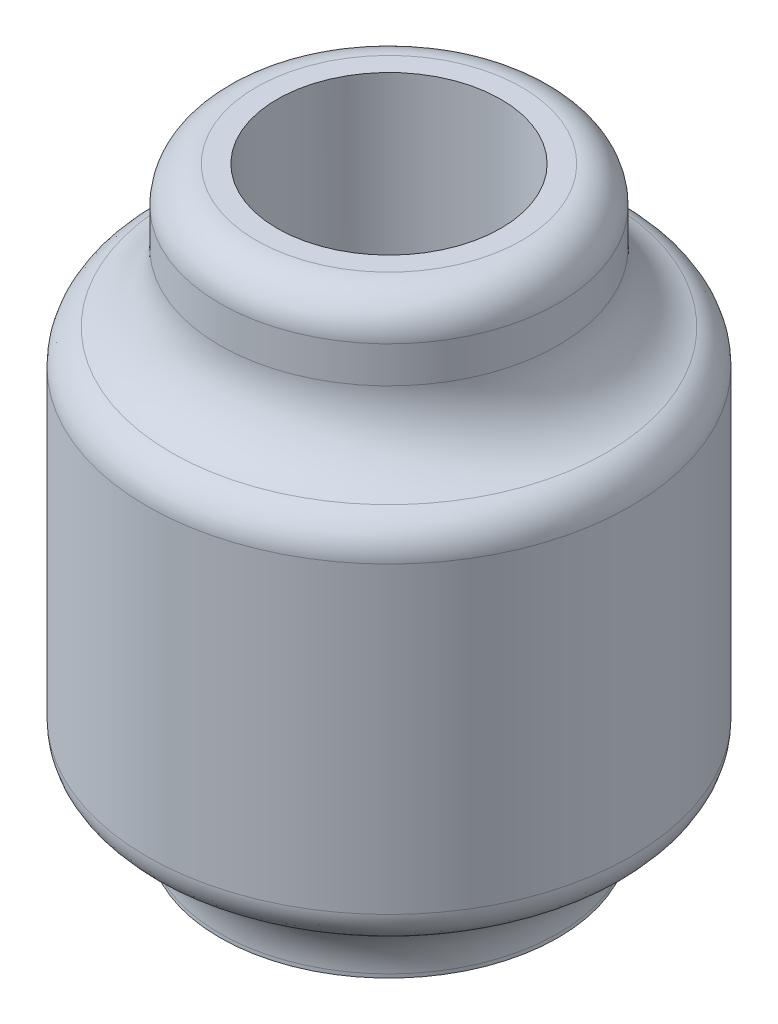
from build123d import *
from build123d.topology import SkipClean

# Parameters (mm, degrees)
SKETCH1_R                = 9.3
SKETCH1_R_2              = 6.15
BOSS_EXTRUDE1_DEPTH      = 12.2
BOSS_EXTRUDE2_START      = 4
SKETCH2_R                = 9.3
SKETCH2_R_2              = 6.15
BOSS_EXTRUDE2_DEPTH      = 12
BOSS_EXTRUDE3_DEPTH      = 10
BOSS_EXTRUDE3_DEPTH_BACK = 6
SKETCH3_R                = 13.3
SKETCH3_R_2              = 12.3
SKETCH4_R                = 13.3
SKETCH4_R_2              = 9.3
BOSS_EXTRUDE4_DEPTH      = 2
CUT_EXTRUDE1_START       = -6
CUT_EXTRUDE1_DEPTH       = 6
CUT_EXTRUDE2_START       = -16
CUT_EXTRUDE2_DEPTH       = 6
BOSS_EXTRUDE5_START      = 4
SKETCH7_R                = 9.3
BOSS_EXTRUDE5_DEPTH      = 4
BOSS_EXTRUDE6_START      = 2
SKETCH8_R                = 13.3
SKETCH8_R_2              = 9.3
BOSS_EXTRUDE6_DEPTH      = 2
SKETCH9_R                = 9.3
SKETCH9_R_2              = 6.15
BOSS_EXTRUDE7_DEPTH      = 4
FILLET1_R                = 4
FILLET2_R                = 4
FILLET3_R                = 2
FILLET4_R                = 2
FILLET5_R                = 2


# Some blends are built 0.0001 mm under size
with BuildPart() as part:
    # Sketch1 → Boss-Extrude1 (new body)
    with BuildSketch(Plane(origin=(0, 0, 0), x_dir=(1, 0, 0), z_dir=(0, 1, 0))):
        with Locations(Location((0, 0, 0), (0, 0, 270))):
            Circle(SKETCH1_R)
        with Locations(Location((0, 0, 0), (0, 0, 270))):
            Circle(SKETCH1_R_2, mode=Mode.SUBTRACT)
    extrude(amount=BOSS_EXTRUDE1_DEPTH)

    # Sketch5 → Cut-Extrude1 (cut)
    with BuildSketch(Plane.XZ.offset(CUT_EXTRUDE1_START)):
        with BuildLine():
            Line((9.01494402, 2.284903569), (5.709791212, 2.284903569))
            ThreePointArc((5.709791212, 2.284903569), (6.038945105, 1.163461226), (6.15, 0))
            ThreePointArc((6.15, 0), (6.088696755, -0.866182327), (5.906009163, -1.715096431))
            Line((5.906009163, -1.715096431), (9.140483807, -1.715096431))
            ThreePointArc((9.140483807, -1.715096431), (9.260035081, -0.861249265), (9.3, 0))
            ThreePointArc((9.3, 0), (9.228460852, 1.151308085), (9.01494402, 2.284903569))
        make_face()
        with BuildLine():
            ThreePointArc((2, -5.815711478), (0, -6.15), (-2, -5.815711478))
            Line((-2, -5.815711478), (-2, -9.082400564))
            ThreePointArc((-2, -9.082400564), (0, -9.3), (2, -9.082400564))
            Line((2, -9.082400564), (2, -5.815711478))
        make_face()
        with BuildLine():
            ThreePointArc((-5.815711478, -2), (-6.15, 0), (-5.815711478, 2))
            Line((-5.815711478, 2), (-9.082400564, 2))
            ThreePointArc((-9.082400564, 2), (-9.3, 0), (-9.082400564, -2))
            Line((-9.082400564, -2), (-5.815711478, -2))
        make_face()
        with BuildLine():
            ThreePointArc((-2, 5.815711478), (0, 6.15), (2, 5.815711478))
            Line((2, 5.815711478), (2, 9.082400564))
            ThreePointArc((2, 9.082400564), (0, 9.3), (-2, 9.082400564))
            Line((-2, 9.082400564), (-2, 5.815711478))
        make_face()
    extrude(amount=-CUT_EXTRUDE1_DEPTH, mode=Mode.SUBTRACT)



with BuildPart() as body_2:
    # Sketch2 → Boss-Extrude2 (new body)
    with BuildSketch(Plane(origin=(0, 12.2, 0), x_dir=(1, 0, 0), z_dir=(0, 1, 0)).offset(BOSS_EXTRUDE2_START)):
        with Locations(Location((0, 0, 0), (0, 0, 270))):
            Circle(SKETCH2_R)
        with Locations(Location((0, 0, 0), (0, 0, 270))):
            Circle(SKETCH2_R_2, mode=Mode.SUBTRACT)
    extrude(amount=BOSS_EXTRUDE2_DEPTH)



with BuildPart() as body_3:
    # Sketch3 → Boss-Extrude3 (new, two sides: drawn at the far end of the back side and taken through both)
    with BuildSketch(Plane(origin=(0, 12.2, 0), x_dir=(1, 0, 0), z_dir=(0, 1, 0)).offset(-BOSS_EXTRUDE3_DEPTH_BACK)):
        with Locations(Location((0, 0, 0), (0, 0, 270))):
            Circle(SKETCH3_R)
        with Locations(Location((0, 0, 0), (0, 0, 270))):
            Circle(SKETCH3_R_2, mode=Mode.SUBTRACT)
    extrude(amount=BOSS_EXTRUDE3_DEPTH + BOSS_EXTRUDE3_DEPTH_BACK)


with BuildPart() as body_2_1:
    add(body_2.part)

    add(body_3.part)  # Boss-Extrude4 merges body 3
    # Sketch4 → Boss-Extrude4 (add)
    with BuildSketch(Plane(origin=(0, 22.2, 0), x_dir=(1, 0, 0), z_dir=(0, 1, 0))):
        with Locations(Location((0, 0, 0), (0, 0, 270))):
            Circle(SKETCH4_R)
        with Locations(Location((0, 0, 0), (0, 0, 270))):
            Circle(SKETCH4_R_2, mode=Mode.SUBTRACT)
    extrude(amount=BOSS_EXTRUDE4_DEPTH)

    # Sketch6 → Cut-Extrude2 (cut)
    with BuildSketch(Plane.XZ.offset(CUT_EXTRUDE2_START)):
        with BuildLine():
            ThreePointArc((2, -5.815711478), (0, -6.15), (-2, -5.815711478))
            Line((-2, -5.815711478), (-2, -9.082400564))
            ThreePointArc((-2, -9.082400564), (0, -9.3), (2, -9.082400564))
            Line((2, -9.082400564), (2, -5.815711478))
        make_face()
        with BuildLine():
            Line((-9.082400564, -2), (-5.815711478, -2))
            ThreePointArc((-5.815711478, -2), (-6.15, 0), (-5.815711478, 2))
            Line((-5.815711478, 2), (-9.082400564, 2))
            ThreePointArc((-9.082400564, 2), (-9.3, 0), (-9.082400564, -2))
        make_face()
        with BuildLine():
            Line((-2, 9.082400564), (-2, 5.815711478))
            ThreePointArc((-2, 5.815711478), (0, 6.15), (2, 5.815711478))
            Line((2, 5.815711478), (2, 9.082400564))
            ThreePointArc((2, 9.082400564), (0, 9.3), (-2, 9.082400564))
        make_face()
        with BuildLine():
            Line((9.082400564, 2), (5.815711478, 2))
            ThreePointArc((5.815711478, 2), (6.06585219, 1.01387238), (6.15, 0))
            ThreePointArc((6.15, 0), (6.06585219, -1.01387238), (5.815711478, -2))
            Line((5.815711478, -2), (9.082400564, -2))
            ThreePointArc((9.082400564, -2), (9.245440099, -1.005901277), (9.3, 0))
            ThreePointArc((9.3, 0), (9.245440099, 1.005901277), (9.082400564, 2))
        make_face()
    extrude(amount=-CUT_EXTRUDE2_DEPTH, mode=Mode.SUBTRACT)


with BuildPart() as part_1:
    add(part.part)

    add(body_2_1.part)  # Boss-Extrude5 merges body 2
    # Sketch7 → Boss-Extrude5 (add)
    with BuildSketch(Plane.XZ.offset(-16.2).offset(BOSS_EXTRUDE5_START)):
        with Locations(Location((0, 0, 0), (0, 0, 90))):
            Circle(SKETCH7_R)
    extrude(amount=-BOSS_EXTRUDE5_DEPTH)

    # Sketch8 → Boss-Extrude6 (add)
    with BuildSketch(Plane.XZ.offset(-6.2).offset(BOSS_EXTRUDE6_START)):
        with Locations(Location((0, 0, 0), (0, 0, 270))):
            Circle(SKETCH8_R)
        with Locations(Location((0, 0, 0), (0, 0, 282.418681506))):
            Circle(SKETCH8_R_2, mode=Mode.SUBTRACT)
    extrude(amount=-BOSS_EXTRUDE6_DEPTH)

    # Sketch9 → Boss-Extrude7 (add)
    with SkipClean():  # the faces are left unmerged after this step: merging them gives an invalid solid
        with BuildSketch(Plane(origin=(0, 28.2, 0), x_dir=(1, 0, 0), z_dir=(0, 1, 0))):
            with Locations(Location((0, 0, 0), (0, 0, 77.581318494))):
                Circle(SKETCH9_R)
            with Locations(Location((0, 0, 0), (0, 0, 90))):
                Circle(SKETCH9_R_2, mode=Mode.SUBTRACT)
        extrude(amount=BOSS_EXTRUDE7_DEPTH)

    # Fillet1
    fillet1_edges = [part_1.edges().sort_by_distance(p)[0] for p in [
        (0, 4.2, -9.3),
    ]]
    fillet(fillet1_edges, radius=FILLET1_R - 0.0001)  # a hair under: the kernel refuses the full size

    # Fillet2
    fillet2_edges = [part_1.edges().sort_by_distance(p)[0] for p in [
        (0, 24.2, -9.3),
    ]]
    fillet(fillet2_edges, radius=FILLET2_R - 0.0001)  # a hair under: the kernel refuses the full size

    # Fillet3
    fillet3_edges = [part_1.edges().sort_by_distance(p)[0] for p in [
        (-2, 32.2, 9.082400564),
    ]]
    fillet(fillet3_edges, radius=FILLET3_R)

    # Fillet4
    # the kernel refuses this fillet: 2 mm, written as the material it takes off along each edge
    with BuildSketch(Plane(origin=(0, 24.2, 0), x_dir=(0, 0, 1), z_dir=(-1, 0, 0))) as fillet4_piece_1:
        with BuildLine():
            CenterArc((11.3, -1.656883538), FILLET4_R, 0, 70.529454613)
            Line((13.3, -1.656883538), (13.5, -1.656883538))
            Line((13.5, -1.656883538), (13.5, 0))
            Line((13.5, 0), (13.3, 0.2))
            ThreePointArc((13.3, 0.2), (13.2999, 0.2), (12.033308888, 0.417304996))
            Line((12.033308888, 0.417304996), (11.966644444, 0.228742402))
        make_face()
    revolve(axis=Axis((0, 24.2, 0), (0, 1, 0)), mode=Mode.SUBTRACT)

    # Fillet5
    # the kernel refuses this fillet: 2 mm, written as the material it takes off along each edge
    with BuildSketch(Plane(origin=(0, 4.2, 0), x_dir=(0, 0, -1), z_dir=(-1, 0, 0))) as fillet5_piece_1:
        with BuildLine():
            CenterArc((11.3, -1.656883538), FILLET5_R, 0, 70.529454613)
            Line((11.966644444, 0.228742402), (12.033308888, 0.417304996))
            ThreePointArc((12.033308888, 0.417304996), (13.2999, 0.2), (13.3, 0.2))
            Line((13.3, 0.2), (13.5, 0))
            Line((13.5, 0), (13.5, -1.656883538))
            Line((13.5, -1.656883538), (13.3, -1.656883538))
        make_face()
    revolve(axis=Axis((0, 4.2, 0), (0, -1, 0)), mode=Mode.SUBTRACT)


solid = part_1.part
